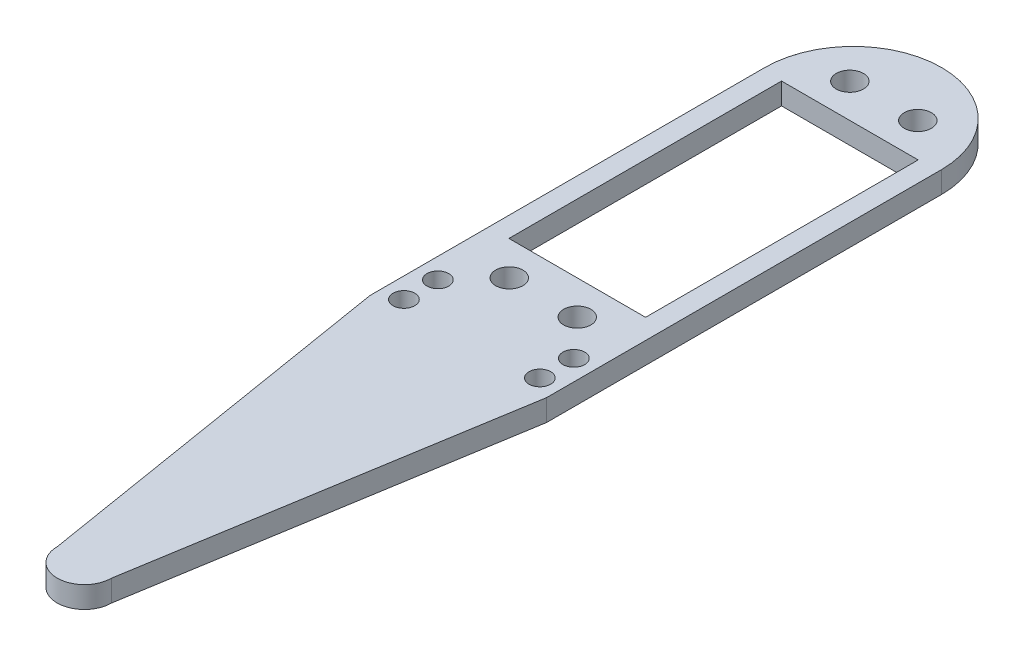
from build123d import *

# Parameters (mm, degrees)
SKETCH2_R               = 2
SKETCH2_W               = 20.1
SKETCH2_H               = 40.1
BOSS_EXTRUDE1_DEPTH     = 3.175
CUT_EXTRUDE1_DEPTH      = 118.862167912
CUT_EXTRUDE1_DEPTH_BACK = 118.862167912
SKETCH3_R               = 1.6


with BuildPart() as part:
    # Sketch2 → Boss-Extrude1 (new body)
    with BuildSketch(Plane(origin=(0, 0, 0), x_dir=(1, 0, 0), z_dir=(0, 1, 0))):
        with BuildLine():
            Line((-13, 0), (-13, -58.1))
            Line((-13, -58.1), (-4, -113.1))
            ThreePointArc((-4, -113.1), (0, -117.1), (4, -113.1))
            Line((4, -113.1), (13, -58.1))
            Line((13, -58.1), (13, 0))
            ThreePointArc((13, 0), (0, 13), (-13, 0))
        make_face()
        with Locations((-5, 4.5)):
            Circle(SKETCH2_R, mode=Mode.SUBTRACT)
        with Locations((-5, -45.6)):
            Circle(SKETCH2_R, mode=Mode.SUBTRACT)
        with Locations((5, -45.6)):
            Circle(SKETCH2_R, mode=Mode.SUBTRACT)
        with Locations((5, 4.5)):
            Circle(SKETCH2_R, mode=Mode.SUBTRACT)
        with Locations((0, -20.55)):
            Rectangle(SKETCH2_W, SKETCH2_H, mode=Mode.SUBTRACT)
    extrude(amount=BOSS_EXTRUDE1_DEPTH)

    # Sketch3 → Cut-Extrude1 (cut, two sides: drawn at the far end of the back side and taken through both)
    with BuildSketch(Plane(origin=(0, 3.175, 0), x_dir=(1, 0, 0), z_dir=(0, 1, 0)).offset(-CUT_EXTRUDE1_DEPTH_BACK)):
        with Locations((10, -56.1)):
            Circle(SKETCH3_R)
        with Locations((10, -51.1)):
            Circle(SKETCH3_R)
        with Locations((-10, -56.1)):
            Circle(SKETCH3_R)
        with Locations((-10, -51.1)):
            Circle(SKETCH3_R)
    extrude(amount=CUT_EXTRUDE1_DEPTH + CUT_EXTRUDE1_DEPTH_BACK, mode=Mode.SUBTRACT)


solid = part.part
